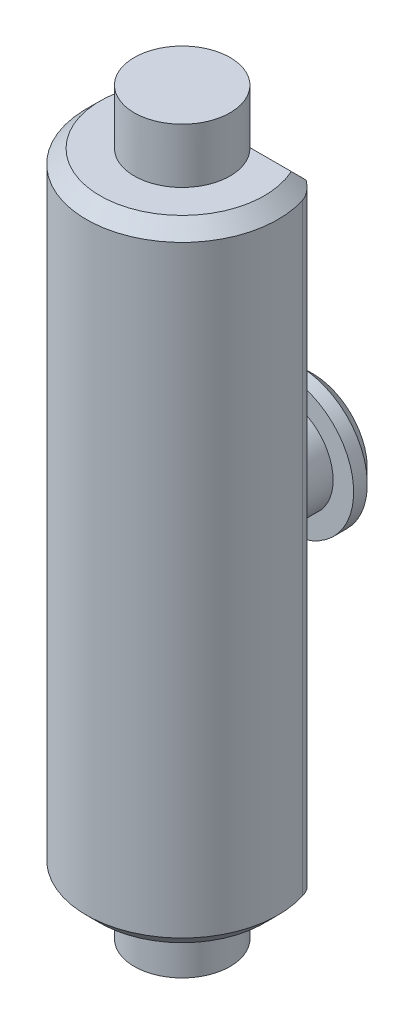
from build123d import *

# Parameters (mm, degrees)
EXTRUDE_1_DEPTH     = 23
SKETCH_2_R          = 1.75
EXTRUDE_2_DEPTH     = 2
EXTRUDE_START       = 2
SKETCH_3_R          = 1.75
EXTRUDE_3_DEPTH     = 2
SKETCH_4_R          = 1.75
EXTRUDE_4_DEPTH     = 2
SKETCH_5_R          = 2.5
EXTRUDE_5_DEPTH     = 1
CHAMFER_1_SIZE      = 0.5
SKETCH_6_R          = 0.75
CUT_EXTRUDE_1_DEPTH = 0.5
CHAMFER_2_SIZE      = 0.2
CHAMFER_3_SIZE      = 0.5
FILLET_3_R          = 1


with BuildPart() as part:
    # 草图1 → 凸台-拉伸1 (new body)
    with BuildSketch(Plane(origin=(0, 0, 0), x_dir=(1, 0, 0), z_dir=(0, 1, 0))):
        with BuildLine():
            Line((-3.024810761, 1.76082931), (3.024810761, 1.76082931))
            ThreePointArc((3.024810761, 1.76082931), (0, -3.5), (-3.024810761, 1.76082931))
        make_face()
    extrude(amount=EXTRUDE_1_DEPTH)

    # 草图2 → 凸台-拉伸2 (add)
    with BuildSketch(Plane(origin=(0, 23, 0), x_dir=(1, 0, 0), z_dir=(0, 1, 0))):
        with Locations(Location((0, 0, 0), (0, 0, 270))):
            Circle(SKETCH_2_R)
    extrude(amount=EXTRUDE_2_DEPTH)

    # 草图3 → 凸台-拉伸3 (add)
    with BuildSketch(Plane.XZ.offset(EXTRUDE_START)):
        with Locations(Location((0, 0, 0), (0, 0, 90))):
            Circle(SKETCH_3_R)
    extrude(amount=-EXTRUDE_3_DEPTH)

    # 草图4 → 凸台-拉伸4 (add)
    with BuildSketch(Plane(origin=(0, 0, -1.76082931), x_dir=(-1, 0, 0), z_dir=(0, 0, -1))):
        with Locations(Location((0, 11.5, 0), (0, 0, 180))):
            Circle(SKETCH_4_R)
    extrude(amount=EXTRUDE_4_DEPTH)

    # 草图5 → 凸台-拉伸5 (add)
    with BuildSketch(Plane(origin=(0, 0, -3.76082931), x_dir=(-1, 0, 0), z_dir=(0, 0, -1))):
        with Locations((0, 11.5)):
            Circle(SKETCH_5_R)
    extrude(amount=EXTRUDE_5_DEPTH)

    # 倒角1
    chamfer_1_edges = [part.edges().sort_by_distance(p)[0] for p in [
        (2.5, 11.5, -4.76082931),
    ]]
    chamfer(chamfer_1_edges, length=CHAMFER_1_SIZE)

    # 草图6 → 切除-拉伸1 (cut)
    with BuildSketch(Plane(origin=(0, 0, -4.76082931), x_dir=(-1, 0, 0), z_dir=(0, 0, -1))):
        with Locations((0, 11.5)):
            Circle(SKETCH_6_R)
    extrude(amount=-CUT_EXTRUDE_1_DEPTH, mode=Mode.SUBTRACT)

    # 倒角2
    chamfer_2_edges = [part.edges().sort_by_distance(p)[0] for p in [
        (0.75, 11.5, -4.76082931),
    ]]
    chamfer(chamfer_2_edges, length=CHAMFER_2_SIZE)

    # 倒角3
    # the kernel refuses this chamfer: 0.5 mm, written as the material it takes off along each edge
    with BuildSketch(Plane(origin=(-4.310652255, 0, -1.76082931), x_dir=(0, 0.9996219169112968, -0.027495876610586494), z_dir=(1, 0, 0))) as chamfer_3_piece_1_section:
        Polygon((CHAMFER_3_SIZE * 0.999621916911, CHAMFER_3_SIZE * 0.0274958766106), (-CHAMFER_3_SIZE * 0.0274958766106, CHAMFER_3_SIZE * 0.999621916911), (0, 0), align=None)
    chamfer_3_piece_1 = extrude(amount=8.62130451, mode=Mode.PRIVATE)
    chamfer_3_piece_1 = chamfer_3_piece_1 - Plane(origin=(0, 0.410648891, 0), x_dir=(0, 0, 1), z_dir=(0, -1, 0)) * Cylinder(1.75, 20, mode=Mode.PRIVATE)
    add(chamfer_3_piece_1, mode=Mode.SUBTRACT)
    with BuildSketch(Plane(origin=(0, 0, 0), x_dir=(0.625040137107155, 0, -0.7805926127020859), z_dir=(-0.7805926127020859, 0, -0.625040137107155))) as chamfer_3_piece_2:
        Polygon((3.5, -CHAMFER_3_SIZE), (3.5 - CHAMFER_3_SIZE, 0), (3.5, 0), align=None)
    revolve(axis=Axis((0, 0, 0), (0, -1, 0)), revolution_arc=282.629733058, mode=Mode.SUBTRACT)
    with BuildSketch(Plane(origin=(0, 23, 0), x_dir=(0.6250401371071543, 0, -0.7805926127020866), z_dir=(-0.7805926127020866, 0, -0.6250401371071543))) as chamfer_3_piece_3:
        Polygon((3.5, CHAMFER_3_SIZE), (3.5 - CHAMFER_3_SIZE, 0), (3.5, 0), align=None)
    revolve(axis=Axis((0, 23, 0), (0, -1, 0)), revolution_arc=282.629733058, mode=Mode.SUBTRACT)
    with BuildSketch(Plane(origin=(-4.310652255, 23, -1.76082931), x_dir=(0, -0.9996219169112968, -0.027495876610586414), z_dir=(1, 0, 0))) as chamfer_3_piece_4_section:
        Polygon((CHAMFER_3_SIZE * 0.999621916911, -CHAMFER_3_SIZE * 0.0274958766106), (-CHAMFER_3_SIZE * 0.0274958766106, -CHAMFER_3_SIZE * 0.999621916911), (0, 0), align=None)
    chamfer_3_piece_4 = extrude(amount=8.62130451, mode=Mode.PRIVATE)
    chamfer_3_piece_4 = chamfer_3_piece_4 - Plane(origin=(0, 22.589351109, 0), x_dir=(0, 0, 1), z_dir=(0, -1, 0)) * Cylinder(1.75, 20, mode=Mode.PRIVATE)
    add(chamfer_3_piece_4, mode=Mode.SUBTRACT)

    # 圆角3
    fillet_3_edges = [part.edges().sort_by_distance(p)[0] for p in [
        (3.024810761, 11.5, -1.76082931),
        (-3.024810761, 11.5, -1.76082931),
    ]]
    fillet(fillet_3_edges, radius=FILLET_3_R)


solid = part.part
